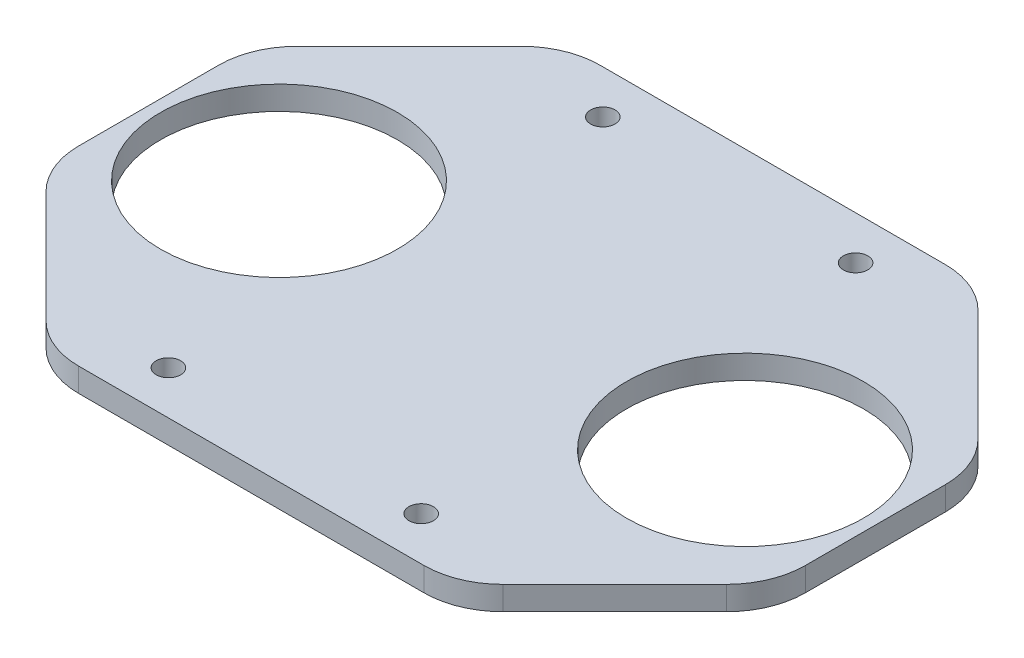
from build123d import *

# Parameters (mm, degrees)
SKETCH_1_W               = 92
SKETCH_1_H               = 66
SKETCH_1_R               = 1.55
EXTRUDE_1_DEPTH          = 3
CHAMFER_1_SIZE           = 20
CUT_EXTRUDE_1_DEPTH      = 57.692151132
CUT_EXTRUDE_1_DEPTH_BACK = 57.692151132
SKETCH_3_R               = 15
FILLET_1_R               = 10


with BuildPart() as part:
    # 草图1 → 凸台-拉伸1 (new body)
    with BuildSketch(Plane(origin=(0, 0, 0), x_dir=(1, 0, 0), z_dir=(0, 1, 0))):
        Rectangle(SKETCH_1_W, SKETCH_1_H)
        with Locations((-16, 27.5)):
            Circle(SKETCH_1_R, mode=Mode.SUBTRACT)
        with Locations((16, 27.5)):
            Circle(SKETCH_1_R, mode=Mode.SUBTRACT)
        with Locations((16, -27.5)):
            Circle(SKETCH_1_R, mode=Mode.SUBTRACT)
        with Locations((-16, -27.5)):
            Circle(SKETCH_1_R, mode=Mode.SUBTRACT)
    extrude(amount=EXTRUDE_1_DEPTH)

    # 倒角1
    chamfer_1_edges = [part.edges().sort_by_distance(p)[0] for p in [
        (-46, 1.5, 33),
        (46, 1.5, 33),
        (46, 1.5, -33),
        (-46, 1.5, -33),
    ]]
    chamfer(chamfer_1_edges, length=CHAMFER_1_SIZE)

    # 草图3 → 切除-拉伸1 (cut, two sides: drawn at the far end of the back side and taken through both)
    with BuildSketch(Plane(origin=(0, 3, 0), x_dir=(1, 0, 0), z_dir=(0, 1, 0)).offset(-CUT_EXTRUDE_1_DEPTH_BACK)):
        with Locations((-29.5, 0)):
            Circle(SKETCH_3_R)
        with Locations((29.5, 0)):
            Circle(SKETCH_3_R)
    extrude(amount=CUT_EXTRUDE_1_DEPTH + CUT_EXTRUDE_1_DEPTH_BACK, mode=Mode.SUBTRACT)

    # 圆角1
    fillet_1_edges = [part.edges().sort_by_distance(p)[0] for p in [
        (26, 1.5, -33),
        (46, 1.5, -13),
        (46, 1.5, 13),
        (26, 1.5, 33),
        (-26, 1.5, 33),
        (-46, 1.5, 13),
        (-46, 1.5, -13),
        (-26, 1.5, -33),
    ]]
    fillet(fillet_1_edges, radius=FILLET_1_R)


solid = part.part
